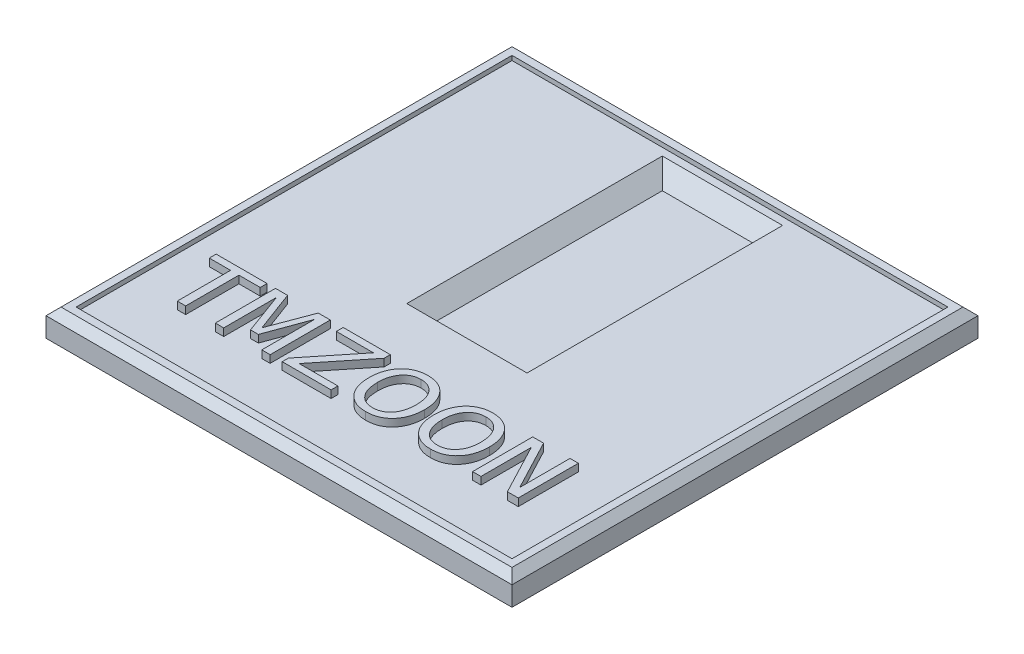
from build123d import *

# Parameters (mm, degrees)
SKETCH1_W                = 300
SKETCH1_H                = 300
SKETCH1_W_2              = 60
SKETCH1_H_2              = 150
BOSS_EXTRUDE1_DEPTH      = 10
SKETCH10_W               = 110
SKETCH10_H               = 195
BOSS_EXTRUDE3_DEPTH      = 15
SHELL1_START             = -10
SHELL1_OUTLINE_W         = 100
SHELL1_OUTLINE_H         = 185
SHELL1_DEPTH             = 10
SHELL1_2_OUTLINE_W       = 100
SHELL1_2_OUTLINE_H       = 185
SHELL1_2_OUTLINE_W_2     = 70
SHELL1_2_OUTLINE_H_2     = 160
SHELL1_2_DEPTH           = 5
CHAMFER1_SIZE            = 10
BOSS_EXTRUDE4_DEPTH      = 3
BOSS_EXTRUDE4_DEPTH_BACK = 15
SKETCH11_W               = 290
SKETCH11_H               = 290
CHAMFER2_SIZE            = 5
CUT_EXTRUDE9_DEPTH       = 5
BOSS_EXTRUDE5_DEPTH      = 5


# Read off the part's stored shape, not the designer's step: Shell1
with BuildPart() as part:
    # Sketch1 → Boss-Extrude1 (new body)
    with BuildSketch(Plane(origin=(0, 0, 0), x_dir=(1, 0, 0), z_dir=(0, 1, 0))):
        with Locations((-4.299319215, -10.667494877)):
            Rectangle(SKETCH1_W, SKETCH1_H)
        with Locations((-4.299319215, 44.332505123)):
            Rectangle(SKETCH1_W_2, SKETCH1_H_2, mode=Mode.SUBTRACT)
    extrude(amount=BOSS_EXTRUDE1_DEPTH)

    # Sketch10 → Boss-Extrude3 (add)
    with BuildSketch(Plane.XZ):
        with Locations((-4.299319215, -41.832505123)):
            Rectangle(SKETCH10_W, SKETCH10_H)
    extrude(amount=BOSS_EXTRUDE3_DEPTH)

    # Shell1 outline → Shell1 (cut)
    with BuildSketch(Plane(origin=(0, 0, 0), x_dir=(1, 0, 0), z_dir=(0, 1, 0)).offset(SHELL1_START)):
        with Locations((-4.299319215, 41.832505123)):
            Rectangle(SHELL1_OUTLINE_W, SHELL1_OUTLINE_H)
    extrude(amount=SHELL1_DEPTH, mode=Mode.SUBTRACT)

    # Shell1 2 outline → Shell1 2 (cut)
    with BuildSketch(Plane(origin=(0, 0, 0), x_dir=(1, 0, 0), z_dir=(0, 1, 0))):
        with Locations((-4.299319215, 41.832505123)):
            Rectangle(SHELL1_2_OUTLINE_W, SHELL1_2_OUTLINE_H)
        with Locations((-4.299319215, 44.332505123)):
            Rectangle(SHELL1_2_OUTLINE_W_2, SHELL1_2_OUTLINE_H_2, mode=Mode.SUBTRACT)
    extrude(amount=SHELL1_2_DEPTH, mode=Mode.SUBTRACT)

    # Chamfer1
    chamfer1_edges = [part.edges().sort_by_distance(p)[0] for p in [
        (-4.299319215, 10, 30.667494877),
        (-4.299319215, 10, -119.332505123),
        (-34.299319215, 10, -44.332505123),
        (25.700680785, 10, -44.332505123),
    ]]
    chamfer(chamfer1_edges, length=CHAMFER1_SIZE - 0.0001)  # a hair under: the kernel refuses the full size

    # Sketch11 → Boss-Extrude4 (add, two sides: drawn at the far end of the back side and taken through both)
    with BuildSketch(Plane(origin=(0, 10, 0), x_dir=(1, 0, 0), z_dir=(0, 1, 0)).offset(-BOSS_EXTRUDE4_DEPTH_BACK)):
        Polygon((-145.299319215, -165.667494877), (-159.299319215, -165.667494877), (-159.299319215, 144.332505123), (150.700680785, 144.332505123), (150.700680785, -165.667494877), (144.700680785, -165.667494877), align=None)
        with Locations((-4.299319215, -10.667494877)):
            Rectangle(SKETCH11_W, SKETCH11_H, mode=Mode.SUBTRACT)
    extrude(amount=BOSS_EXTRUDE4_DEPTH + BOSS_EXTRUDE4_DEPTH_BACK)

    # Chamfer2
    chamfer2_edges = [part.edges().sort_by_distance(p)[0] for p in [
        (-4.299319215, 13, 165.667494877),
        (150.700680785, 13, 10.667494877),
        (-4.299319215, 13, -144.332505123),
        (-159.299319215, 13, 10.667494877),
    ]]
    chamfer(chamfer2_edges, length=CHAMFER2_SIZE)

    # Sketch12 → Cut-Extrude9 (cut)
    with BuildSketch(Plane.XZ.offset(5)):
        Polygon((-154.299319215, -139.332505123), (-154.299319215, 160.667494877), (145.700680785, 160.667494877), (145.700680785, -139.332505123), (50.700680785, -139.332505123), (50.700680785, -134.332505123), (140.700680785, -134.332505123), (140.700680785, 155.667494877), (-149.299319215, 155.667494877), (-149.299319215, -134.332505123), (-59.299319215, -134.332505123), (-59.299319215, -139.332505123), align=None)
    extrude(amount=-CUT_EXTRUDE9_DEPTH, mode=Mode.SUBTRACT)

    # Sketch2 → Boss-Extrude5 (add)
    # profile 1 of 6: a face of its own
    with BuildSketch(Plane(origin=(0, 10, 0), x_dir=(1, 0, 0), z_dir=(0, 1, 0))):
        Polygon((-131.21624392, -80.575415054), (-97.339661642, -80.575415054), (-97.339661642, -85.132377079), (-111.493142654, -85.132377079), (-111.493142654, -120.575415054), (-117.062762908, -120.575415054), (-117.062762908, -85.132377079), (-131.21624392, -85.132377079), align=None)
    # profile 2 of 6: a face of its own
    with BuildSketch(Plane(origin=(0, 10, 0), x_dir=(1, 0, 0), z_dir=(0, 1, 0))):
        Polygon((-91.746307211, -80.575415054), (-83.684598351, -80.575415054), (-73.542193287, -107.814339105), (-63.296940123, -80.575415054), (-55.290611009, -80.575415054), (-55.290611009, -120.575415054), (-60.860231262, -120.575415054), (-60.860231262, -85.456744168), (-70.891876832, -112.79851632), (-76.145041389, -112.79851632), (-86.176686958, -85.456744168), (-86.176686958, -120.575415054), (-91.746307211, -120.575415054), align=None)
    # profile 3 of 6: a face of its own
    with BuildSketch(Plane(origin=(0, 10, 0), x_dir=(1, 0, 0), z_dir=(0, 1, 0))):
        Polygon((-46.67510468, -80.575415054), (-15.330167971, -80.575415054), (-15.330167971, -84.705161889), (-40.535864173, -116.018453029), (-14.744724933, -116.018453029), (-14.744724933, -120.575415054), (-47.260547718, -120.575415054), (-47.260547718, -116.445668219), (-22.054851515, -85.132377079), (-46.67510468, -85.132377079), align=None)
    # profile 4 of 6: a face of its own
    with BuildSketch(Plane(origin=(0, 10, 0), x_dir=(1, 0, 0), z_dir=(0, 1, 0))):
        with BuildLine():
            add(Edge.make_bspline(
                [(9.290085194, -80.06908594), (9.974073341, -80.084148498), (11.310689578, -80.113583013), (13.260649362, -80.391920081), (15.106653997, -80.831117373), (16.849428762, -81.451569572), (18.491278204, -82.242535611), (20.018011456, -83.227075035), (21.445294187, -84.378383578), (22.742736743, -85.711965735), (23.923191014, -87.178230386), (24.948174936, -88.782081539), (25.821292346, -90.500672289), (26.524558759, -92.34561481), (27.081062845, -94.301103419), (27.460559423, -96.381139758), (27.705427106, -98.575879019), (27.733165304, -100.081586338), (27.747363675, -100.852313788)],
                knots=[0, 0, 0, 0, 1.046974495, 2.045946433, 3.009842023, 3.948749427, 4.873574893, 5.794485429, 6.724850033, 7.675874877, 8.638390309, 9.602979465, 10.585554, 11.585350169, 12.622203588, 13.694728314, 14.819998983, 16, 16, 16, 16], degree=3))
            add(Edge.make_bspline(
                [(27.747363675, -100.852313788), (27.733360216, -101.620433421), (27.706052588, -103.118315093), (27.458888073, -105.304786593), (27.082600092, -107.377596078), (26.522615744, -109.329380631), (25.82354534, -111.170768893), (24.945890697, -112.884522684), (23.923082436, -114.486590742), (22.745348639, -115.953073966), (21.442503045, -117.278687682), (20.018288176, -118.430202939), (18.49146886, -119.415386657), (16.847572785, -120.202765228), (15.10966812, -120.838811373), (13.259105512, -121.261777589), (11.310940248, -121.544527442), (9.974158194, -121.573332723), (9.290085194, -121.588073282)],
                knots=[0, 0, 0, 0, 1.177584306, 2.296363576, 3.370365481, 4.404756482, 5.405929662, 6.386251896, 7.352169572, 8.316010668, 9.265464185, 10.197110173, 11.11928907, 12.045388291, 12.986953489, 13.951235703, 14.951583516, 16, 16, 16, 16], degree=3))
            add(Edge.make_bspline(
                [(9.290085194, -121.588073282), (8.606229291, -121.572062786), (7.270228859, -121.540784223), (5.31877151, -121.275804747), (3.473734655, -120.833060284), (1.730268991, -120.214422392), (0.089812303, -119.419412147), (-1.445662759, -118.44704587), (-2.880455279, -117.302852582), (-4.186000078, -115.97729875), (-5.375760159, -114.517426057), (-6.40820132, -112.920546081), (-7.270586102, -111.198094265), (-7.985669865, -109.363439455), (-8.539532826, -107.405442837), (-8.929812707, -105.327020141), (-9.172107073, -103.128623244), (-9.200254036, -101.622998811), (-9.214661642, -100.852313788)],
                knots=[0, 0, 0, 0, 1.046993163, 2.04543576, 3.009348536, 3.94827268, 4.873114636, 5.795280634, 6.726275263, 7.67728276, 8.639205072, 9.605998851, 10.583164017, 11.584437137, 12.617423858, 13.694687211, 14.819977944, 16, 16, 16, 16], degree=3))
            add(Edge.make_bspline(
                [(-9.214661642, -100.852313788), (-9.200171734, -100.08164732), (-9.171863983, -98.576059136), (-8.930999209, -96.379982189), (-8.536943533, -94.302485868), (-7.987741722, -92.343153212), (-7.268185706, -90.505086125), (-6.410923222, -88.777360232), (-5.37319323, -87.178592418), (-4.186479207, -85.711538563), (-2.880640578, -84.378237766), (-1.445699114, -83.226663513), (0.087540757, -82.244586114), (1.730563222, -81.451274461), (3.473565845, -80.831199179), (5.31950717, -80.391897163), (7.269484522, -80.113589154), (8.606098303, -80.084150577), (9.290085194, -80.06908594)],
                knots=[0, 0, 0, 0, 1.178933409, 2.303185988, 3.375492215, 4.41140754, 5.41175692, 6.391624662, 7.35752651, 8.321699006, 9.274695168, 10.207356909, 11.130834481, 12.05482321, 12.992881136, 13.95590464, 14.953972757, 16, 16, 16, 16], degree=3))
        make_face()
        with BuildLine():
            add(Edge.make_bspline(
                [(9.266351017, -84.626047965), (8.783105207, -84.640467606), (7.838832288, -84.6686439), (6.458374545, -84.867384027), (5.157509701, -85.206187169), (3.930161808, -85.6863293), (2.783698889, -86.304088278), (1.709513753, -87.056618956), (0.718733958, -87.94852969), (-0.190231776, -88.970655397), (-1.003371013, -90.109076841), (-1.707829247, -91.352260178), (-2.315496603, -92.689898259), (-2.800898513, -94.133038669), (-3.181092839, -95.673278837), (-3.444388433, -97.311346111), (-3.616088906, -99.047502199), (-3.635219877, -100.240069964), (-3.645041389, -100.852313788)],
                knots=[0, 0, 0, 0, 0.992078402, 1.938542973, 2.856561574, 3.746427499, 4.637939252, 5.524223217, 6.432997522, 7.368745408, 8.327383014, 9.299866671, 10.29827865, 11.339356729, 12.421474065, 13.551982278, 14.743229712, 16, 16, 16, 16], degree=3))
            add(Edge.make_bspline(
                [(-3.645041389, -100.852313788), (-3.635194628, -101.459289386), (-3.615975986, -102.643967921), (-3.443629451, -104.37209438), (-3.182046699, -106.005186545), (-2.801074752, -107.540135908), (-2.313850728, -108.977236859), (-1.707946152, -110.312816099), (-1.003484646, -111.556166973), (-0.189677088, -112.693733824), (0.715540646, -113.717682431), (1.715206999, -114.59840426), (2.778420906, -115.364119872), (3.932956156, -115.968465372), (5.157056921, -116.45175313), (6.458500911, -116.789557206), (7.838798493, -116.98857362), (8.783093766, -117.016711351), (9.266351017, -117.031111257)],
                knots=[0, 0, 0, 0, 1.248257537, 2.436315255, 3.568920878, 4.647780726, 5.68565685, 6.685921162, 7.660209049, 8.620625195, 9.558109156, 10.4649585, 11.356013141, 12.24662183, 13.138138705, 14.057860487, 15.006081015, 16, 16, 16, 16], degree=3))
            add(Edge.make_bspline(
                [(9.266351017, -117.031111257), (9.749600952, -117.016698954), (10.693881933, -116.988536998), (12.074281915, -116.789694145), (13.375355624, -116.451262463), (14.598619152, -115.971088288), (15.748225796, -115.358812007), (16.816707237, -114.604096162), (17.808827199, -113.714226158), (18.715474251, -112.694587068), (19.526745683, -111.553704137), (20.242344666, -110.315320017), (20.845922219, -108.976868838), (21.333955605, -107.540240278), (21.714697434, -106.005156604), (21.976346184, -104.37210296), (22.148674049, -102.643965604), (22.167895316, -101.459288602), (22.177743422, -100.852313788)],
                knots=[0, 0, 0, 0, 0.994024979, 1.942346626, 2.862166489, 3.753778437, 4.639694184, 5.535275203, 6.438171751, 7.375755687, 8.336274254, 9.313365839, 10.313736821, 11.351723626, 12.430698526, 13.563424932, 14.751609347, 16, 16, 16, 16], degree=3))
            add(Edge.make_bspline(
                [(22.177743422, -100.852313788), (22.167920548, -100.240070759), (22.148786924, -99.047504543), (21.977105238, -97.31133749), (21.713743472, -95.673308832), (21.333780728, -94.13293352), (20.847564628, -92.690268246), (20.242227059, -91.349756685), (19.526631248, -90.111539894), (18.716030578, -88.96980327), (17.805622712, -87.951975482), (16.822401801, -87.050929652), (15.742946745, -86.309400846), (14.601427044, -85.683706714), (13.374900148, -85.206679596), (12.074409033, -84.867246596), (10.693847937, -84.668680654), (9.749589444, -84.640480048), (9.266351017, -84.626047965)],
                knots=[0, 0, 0, 0, 1.256900501, 2.448271359, 3.578896704, 4.661126157, 5.702312102, 6.700827525, 7.676106732, 8.634843661, 9.5706885, 10.475531073, 11.366345495, 12.253184336, 13.14314246, 14.061256176, 15.007818809, 16, 16, 16, 16], degree=3))
        make_face(mode=Mode.SUBTRACT)
    # profile 5 of 6: a face of its own
    with BuildSketch(Plane(origin=(0, 10, 0), x_dir=(1, 0, 0), z_dir=(0, 1, 0))):
        with BuildLine():
            add(Edge.make_bspline(
                [(52.328059877, -80.06908594), (53.012048024, -80.084148498), (54.348664261, -80.113583013), (56.298624046, -80.391920081), (58.14462868, -80.831117373), (59.887403446, -81.451569572), (61.529252887, -82.242535611), (63.05598614, -83.227075035), (64.483268871, -84.378383578), (65.780711426, -85.711965735), (66.961165697, -87.178230386), (67.986149619, -88.782081539), (68.859267029, -90.500672289), (69.562533443, -92.34561481), (70.119037528, -94.301103419), (70.498534106, -96.381139758), (70.74340179, -98.575879019), (70.771139988, -100.081586338), (70.785338358, -100.852313788)],
                knots=[0, 0, 0, 0, 1.046974495, 2.045946433, 3.009842023, 3.948749427, 4.873574893, 5.794485429, 6.724850033, 7.675874877, 8.638390309, 9.602979465, 10.585554, 11.585350169, 12.622203588, 13.694728314, 14.819998983, 16, 16, 16, 16], degree=3))
            add(Edge.make_bspline(
                [(70.785338358, -100.852313788), (70.771334899, -101.620433421), (70.744027272, -103.118315093), (70.496862757, -105.304786593), (70.120574776, -107.377596078), (69.560590427, -109.329380631), (68.861520023, -111.170768893), (67.983865381, -112.884522684), (66.961057119, -114.486590742), (65.783323323, -115.953073966), (64.480477729, -117.278687682), (63.05626286, -118.430202939), (61.529443544, -119.415386657), (59.885547469, -120.202765228), (58.147642803, -120.838811373), (56.297080195, -121.261777589), (54.348914931, -121.544527442), (53.012132878, -121.573332723), (52.328059877, -121.588073282)],
                knots=[0, 0, 0, 0, 1.177584306, 2.296363576, 3.370365481, 4.404756482, 5.405929662, 6.386251896, 7.352169572, 8.316010668, 9.265464185, 10.197110173, 11.11928907, 12.045388291, 12.986953489, 13.951235703, 14.951583516, 16, 16, 16, 16], degree=3))
            add(Edge.make_bspline(
                [(52.328059877, -121.588073282), (51.644203975, -121.572062786), (50.308203543, -121.540784223), (48.356746193, -121.275804747), (46.511709338, -120.833060284), (44.768243675, -120.214422392), (43.127786986, -119.419412147), (41.592311925, -118.44704587), (40.157519404, -117.302852582), (38.851974606, -115.97729875), (37.662214525, -114.517426057), (36.629773364, -112.920546081), (35.767388581, -111.198094265), (35.052304818, -109.363439455), (34.498441858, -107.405442837), (34.108161977, -105.327020141), (33.865867611, -103.128623244), (33.837720648, -101.622998811), (33.823313042, -100.852313788)],
                knots=[0, 0, 0, 0, 1.046993163, 2.04543576, 3.009348536, 3.94827268, 4.873114636, 5.795280634, 6.726275263, 7.67728276, 8.639205072, 9.605998851, 10.583164017, 11.584437137, 12.617423858, 13.694687211, 14.819977944, 16, 16, 16, 16], degree=3))
            add(Edge.make_bspline(
                [(33.823313042, -100.852313788), (33.83780295, -100.08164732), (33.8661107, -98.576059136), (34.106975474, -96.379982189), (34.50103115, -94.302485868), (35.050232961, -92.343153212), (35.769788977, -90.505086125), (36.627051462, -88.777360232), (37.664781454, -87.178592418), (38.851495477, -85.711538563), (40.157334106, -84.378237766), (41.59227557, -83.226663513), (43.125515441, -82.244586114), (44.768537906, -81.451274461), (46.511540529, -80.831199179), (48.357481854, -80.391897163), (50.307459206, -80.113589154), (51.644072987, -80.084150577), (52.328059877, -80.06908594)],
                knots=[0, 0, 0, 0, 1.178933409, 2.303185988, 3.375492215, 4.41140754, 5.41175692, 6.391624662, 7.35752651, 8.321699006, 9.274695168, 10.207356909, 11.130834481, 12.05482321, 12.992881136, 13.95590464, 14.953972757, 16, 16, 16, 16], degree=3))
        make_face()
        with BuildLine():
            add(Edge.make_bspline(
                [(52.3043257, -84.626047965), (51.82107989, -84.640467606), (50.876806971, -84.6686439), (49.496349229, -84.867384027), (48.195484385, -85.206187169), (46.968136491, -85.6863293), (45.821673573, -86.304088278), (44.747488437, -87.056618956), (43.756708641, -87.94852969), (42.847742908, -88.970655397), (42.034603671, -90.109076841), (41.330145437, -91.352260178), (40.722478081, -92.689898259), (40.237076171, -94.133038669), (39.856881845, -95.673278837), (39.593586251, -97.311346111), (39.421885777, -99.047502199), (39.402754807, -100.240069964), (39.392933295, -100.852313788)],
                knots=[0, 0, 0, 0, 0.992078402, 1.938542973, 2.856561574, 3.746427499, 4.637939252, 5.524223217, 6.432997522, 7.368745408, 8.327383014, 9.299866671, 10.29827865, 11.339356729, 12.421474065, 13.551982278, 14.743229712, 16, 16, 16, 16], degree=3))
            add(Edge.make_bspline(
                [(39.392933295, -100.852313788), (39.402780056, -101.459289386), (39.421998697, -102.643967921), (39.594345233, -104.37209438), (39.855927985, -106.005186545), (40.236899931, -107.540135908), (40.724123956, -108.977236859), (41.330028531, -110.312816099), (42.034490037, -111.556166973), (42.848297596, -112.693733824), (43.753515329, -113.717682431), (44.753181683, -114.59840426), (45.816395589, -115.364119872), (46.97093084, -115.968465372), (48.195031604, -116.45175313), (49.496475594, -116.789557206), (50.876773176, -116.98857362), (51.82106845, -117.016711351), (52.3043257, -117.031111257)],
                knots=[0, 0, 0, 0, 1.248257537, 2.436315255, 3.568920878, 4.647780726, 5.68565685, 6.685921162, 7.660209049, 8.620625195, 9.558109156, 10.4649585, 11.356013141, 12.24662183, 13.138138705, 14.057860487, 15.006081015, 16, 16, 16, 16], degree=3))
            add(Edge.make_bspline(
                [(52.3043257, -117.031111257), (52.787575636, -117.016698954), (53.731856617, -116.988536998), (55.112256599, -116.789694145), (56.413330307, -116.451262463), (57.636593835, -115.971088288), (58.786200479, -115.358812007), (59.854681921, -114.604096162), (60.846801882, -113.714226158), (61.753448934, -112.694587068), (62.564720366, -111.553704137), (63.28031935, -110.315320017), (63.883896903, -108.976868838), (64.371930289, -107.540240278), (64.752672118, -106.005156604), (65.014320867, -104.37210296), (65.186648733, -102.643965604), (65.205869999, -101.459288602), (65.215718105, -100.852313788)],
                knots=[0, 0, 0, 0, 0.994024979, 1.942346626, 2.862166489, 3.753778437, 4.639694184, 5.535275203, 6.438171751, 7.375755687, 8.336274254, 9.313365839, 10.313736821, 11.351723626, 12.430698526, 13.563424932, 14.751609347, 16, 16, 16, 16], degree=3))
            add(Edge.make_bspline(
                [(65.215718105, -100.852313788), (65.205895231, -100.240070759), (65.186761607, -99.047504543), (65.015079921, -97.31133749), (64.751718155, -95.673308832), (64.371755411, -94.13293352), (63.885539312, -92.690268246), (63.280201743, -91.349756685), (62.564605931, -90.111539894), (61.754005262, -88.96980327), (60.843597396, -87.951975482), (59.860376484, -87.050929652), (58.780921429, -86.309400846), (57.639401727, -85.683706714), (56.412874831, -85.206679596), (55.112383717, -84.867246596), (53.731822621, -84.668680654), (52.787564127, -84.640480048), (52.3043257, -84.626047965)],
                knots=[0, 0, 0, 0, 1.256900501, 2.448271359, 3.578896704, 4.661126157, 5.702312102, 6.700827525, 7.676106732, 8.634843661, 9.5706885, 10.475531073, 11.366345495, 12.253184336, 13.14314246, 14.061256176, 15.007818809, 16, 16, 16, 16], degree=3))
        make_face(mode=Mode.SUBTRACT)
    # profile 6 of 6: a face of its own
    with BuildSketch(Plane(origin=(0, 10, 0), x_dir=(1, 0, 0), z_dir=(0, 1, 0))):
        Polygon((79.392933295, -80.575415054), (86.616034561, -80.575415054), (104.203059877, -114.032693535), (104.203059877, -80.575415054), (109.77268013, -80.575415054), (109.77268013, -120.575415054), (102.549578865, -120.575415054), (84.962553548, -87.118136573), (84.962553548, -120.575415054), (79.392933295, -120.575415054), align=None)
    extrude(amount=BOSS_EXTRUDE5_DEPTH)


solid = part.part
